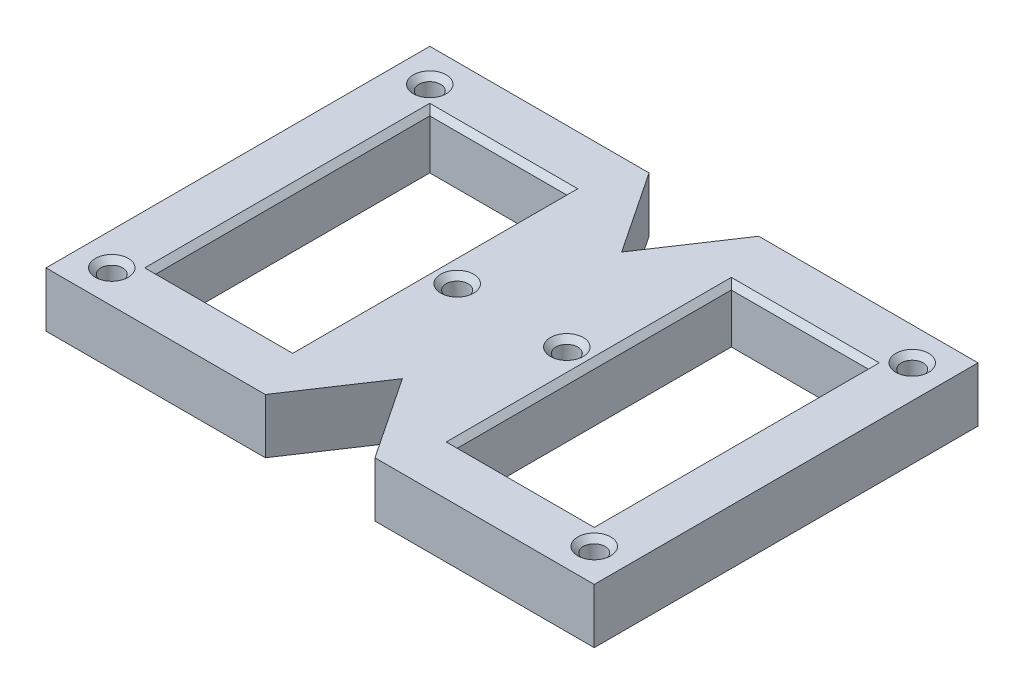
from build123d import *

# Parameters (mm, degrees)
CROQUIS1_W              = 100
CROQUIS1_H              = 70
SALIENTE_EXTRUIR1_DEPTH = 10
CROQUIS3_R              = 2
CORTAR_EXTRUIR2_DEPTH   = 62.846584384
CROQUIS6_R              = 2
CORTAR_EXTRUIR3_DEPTH   = 62.846584384
CROQUIS7_W              = 25
CROQUIS7_H              = 50
CORTAR_EXTRUIR4_DEPTH   = 62.846584384
CORTAR_EXTRUIR5_DEPTH   = 62.846584384
CHAFL_N1_SIZE           = 1


with BuildPart() as part:
    # Croquis1 → Saliente-Extruir1 (new body)
    with BuildSketch(Plane(origin=(0, 0, 0), x_dir=(1, 0, 0), z_dir=(0, 1, 0))):
        Rectangle(CROQUIS1_W, CROQUIS1_H)
    extrude(amount=SALIENTE_EXTRUIR1_DEPTH)

    # Croquis3 → Cortar-Extruir2 (cut, through all)
    with BuildSketch(Plane(origin=(0, 10, 0), x_dir=(1, 0, 0), z_dir=(0, 1, 0))):
        with Locations((-44, 29)):
            Circle(CROQUIS3_R)
        with Locations((44, 29)):
            Circle(CROQUIS3_R)
        with Locations((44, -29)):
            Circle(CROQUIS3_R)
        with Locations((-44, -29)):
            Circle(CROQUIS3_R)
    extrude(amount=-CORTAR_EXTRUIR2_DEPTH, mode=Mode.SUBTRACT)

    # Croquis6 → Cortar-Extruir3 (cut, through all)
    with BuildSketch(Plane(origin=(0, 10, 0), x_dir=(1, 0, 0), z_dir=(0, 1, 0))):
        with Locations((-10, 0)):
            Circle(CROQUIS6_R)
        with Locations((10, 0)):
            Circle(CROQUIS6_R)
    extrude(amount=-CORTAR_EXTRUIR3_DEPTH, mode=Mode.SUBTRACT)

    # Croquis7 → Cortar-Extruir4 (cut, through all)
    with BuildSketch(Plane.XZ):
        with Locations((-27.5, 0)):
            Rectangle(CROQUIS7_W, CROQUIS7_H)
        with Locations((27.5, 0)):
            Rectangle(CROQUIS7_W, CROQUIS7_H)
    extrude(amount=-CORTAR_EXTRUIR4_DEPTH, mode=Mode.SUBTRACT)

    # Croquis8 → Cortar-Extruir5 (cut, through all)
    with BuildSketch(Plane(origin=(0, 10, 0), x_dir=(1, 0, 0), z_dir=(0, 1, 0))):
        Polygon((-10, 35), (0, 20), (10, 35), align=None)
    cortar_extruir5 = extrude(amount=-CORTAR_EXTRUIR5_DEPTH, mode=Mode.SUBTRACT)

    # Simetría1: Cortar-Extruir5 across plane
    add(cortar_extruir5.mirror(Plane.XY), mode=Mode.SUBTRACT)

    # Chaflán1
    chafl_n1_edges = [part.edges().sort_by_distance(p)[0] for p in [
        (42, 10, 29),
        (42, 10, -29),
        (8, 10, 0),
        (-12, 10, 0),
        (-46, 10, 29),
        (-46, 10, -29),
        (27.5, 10, 25),
        (40, 10, 0),
        (15, 10, 0),
        (27.5, 10, -25),
        (-27.5, 10, 25),
        (-15, 10, 0),
        (-27.5, 10, -25),
        (-40, 10, 0),
    ]]
    chamfer(chafl_n1_edges, length=CHAFL_N1_SIZE)


solid = part.part
